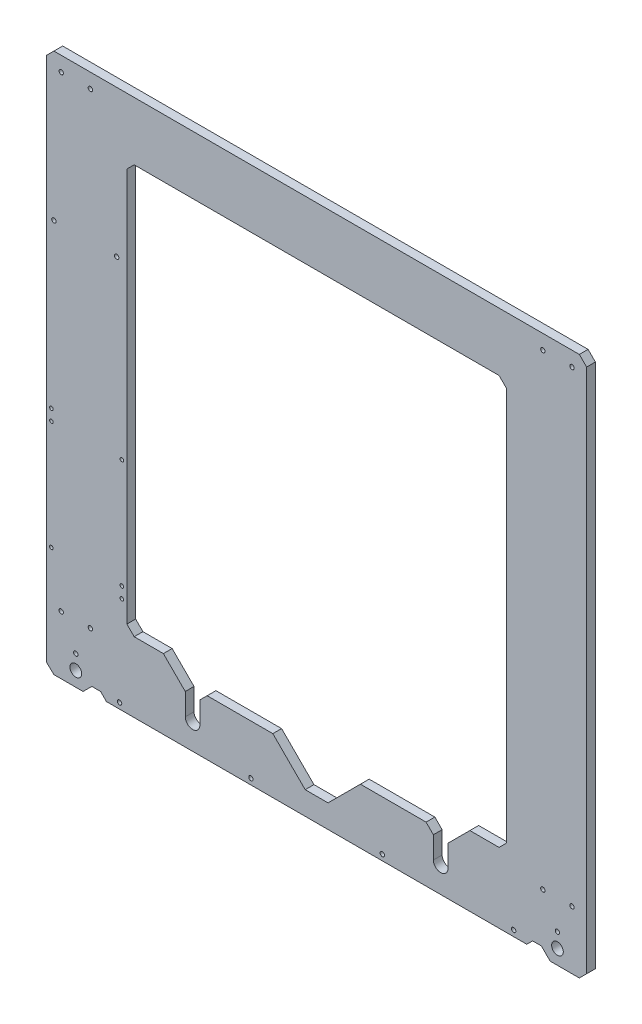
from build123d import *

# Parameters (mm, degrees)
FRAME_R             = 4
FRAME_R_2           = 1.5
FRAME_R_3           = 1.25
BOSS_EXTRUDE1_DEPTH = 6


with BuildPart() as part:
    # FRAME → Boss-Extrude1 (new body)
    with BuildSketch(Plane.XY):
        Polygon((0, 365), (0, 4.808251585), (5, 0), (25, 0), (27, 2), (31, 6), (37, 6), (41, 2), (329, 2), (333, 6), (339, 6), (343, 2), (345, 0), (365, 0), (370, 5), (370, 365), (365, 370), (5, 370), align=None)
        with Locations((20, 10)):
            Circle(FRAME_R, mode=Mode.SUBTRACT)
        with Locations((20, 20)):
            Circle(FRAME_R_2, mode=Mode.SUBTRACT)
        with Locations((10, 40)):
            Circle(FRAME_R_2, mode=Mode.SUBTRACT)
        with Locations((30, 40)):
            Circle(FRAME_R_2, mode=Mode.SUBTRACT)
        with Locations((50, 6)):
            Circle(FRAME_R_2, mode=Mode.SUBTRACT)
        with Locations((3.295108055, 74.610044833)):
            Circle(FRAME_R_3, mode=Mode.SUBTRACT)
        with Locations((51.555108055, 68.260044833)):
            Circle(FRAME_R_3, mode=Mode.SUBTRACT)
        with Locations((51.555108055, 75.880044833)):
            Circle(FRAME_R_3, mode=Mode.SUBTRACT)
        with Locations((140, 6)):
            Circle(FRAME_R_2, mode=Mode.SUBTRACT)
        with Locations((3.295108055, 149.540044833)):
            Circle(FRAME_R_3, mode=Mode.SUBTRACT)
        with Locations((3.295108055, 157.160044833)):
            Circle(FRAME_R_3, mode=Mode.SUBTRACT)
        with Locations((51.555108055, 150.810044833)):
            Circle(FRAME_R_3, mode=Mode.SUBTRACT)
        with Locations((230, 6)):
            Circle(FRAME_R_2, mode=Mode.SUBTRACT)
        with Locations((320, 6)):
            Circle(FRAME_R_2, mode=Mode.SUBTRACT)
        with Locations((350, 10)):
            Circle(FRAME_R, mode=Mode.SUBTRACT)
        with Locations((350, 20)):
            Circle(FRAME_R_2, mode=Mode.SUBTRACT)
        with Locations((340, 40)):
            Circle(FRAME_R_2, mode=Mode.SUBTRACT)
        with Locations((360, 40)):
            Circle(FRAME_R_2, mode=Mode.SUBTRACT)
        with BuildLine():
            ThreePointArc((105, 20), (100, 15), (95, 20))
            Line((95, 20), (95, 35))
            Line((95, 35), (80, 50))
            Line((80, 50), (60, 50))
            Line((60, 50), (55, 55))
            Line((55, 55), (55, 325))
            Line((55, 325), (60, 330))
            Line((60, 330), (310, 330))
            Line((310, 330), (315, 325))
            Line((315, 325), (315, 55))
            Line((315, 55), (310, 50))
            Line((310, 50), (290, 50))
            Line((290, 50), (275, 35))
            Line((275, 35), (275, 20))
            ThreePointArc((275, 20), (270, 15), (265, 20))
            Line((265, 20), (265, 35))
            Line((265, 35), (260, 40))
            Line((260, 40), (215, 40))
            Line((215, 40), (192.824919816, 17.824919816))
            Line((192.824919816, 17.824919816), (177.175080184, 17.824919816))
            Line((177.175080184, 17.824919816), (155, 40))
            Line((155, 40), (110, 40))
            Line((110, 40), (105, 35))
            Line((105, 35), (105, 20))
        make_face(mode=Mode.SUBTRACT)
        with Locations((5, 269.5)):
            Circle(FRAME_R_2, mode=Mode.SUBTRACT)
        with Locations((48, 269.5)):
            Circle(FRAME_R_2, mode=Mode.SUBTRACT)
        with Locations((10, 360)):
            Circle(FRAME_R_2, mode=Mode.SUBTRACT)
        with Locations((30, 360)):
            Circle(FRAME_R_2, mode=Mode.SUBTRACT)
        with Locations((340, 360)):
            Circle(FRAME_R_2, mode=Mode.SUBTRACT)
        with Locations((360, 360)):
            Circle(FRAME_R_2, mode=Mode.SUBTRACT)
    extrude(amount=BOSS_EXTRUDE1_DEPTH)


solid = part.part
